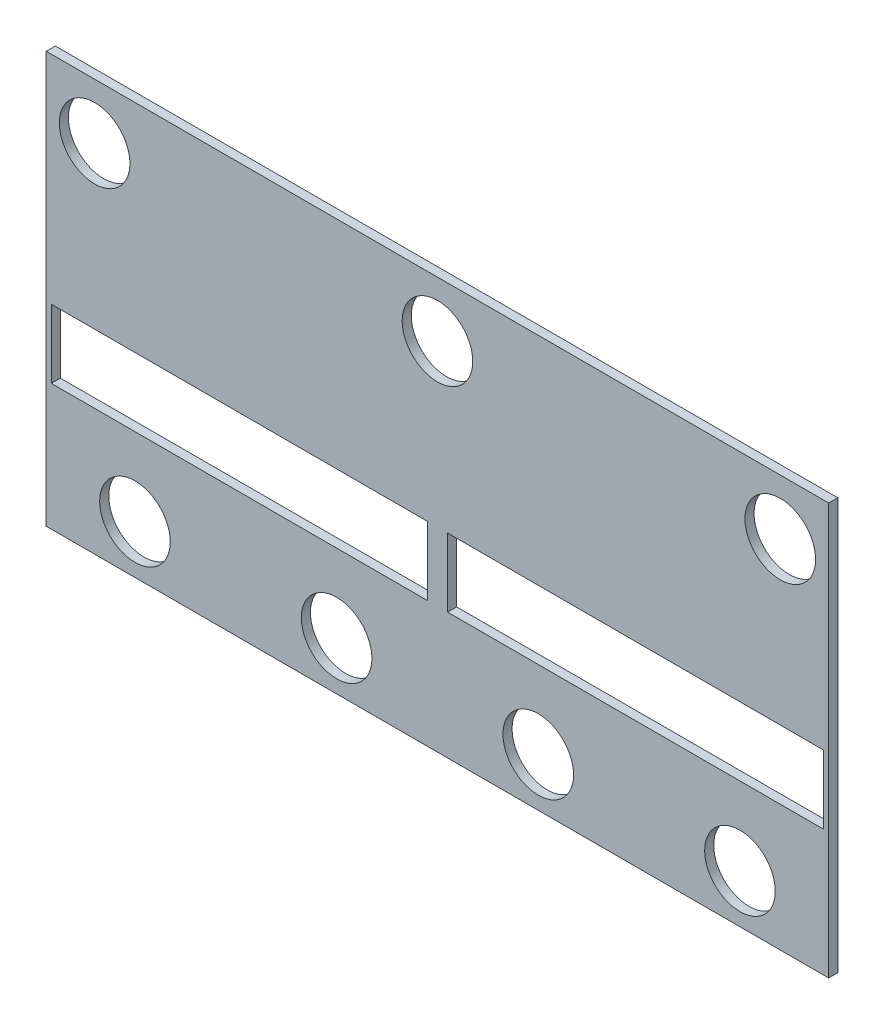
from build123d import *

# Parameters (mm, degrees)
SKETCH14_W                        = 80
SKETCH14_H                        = 42
SKETCH14_W_2                      = 3.75
SKETCH14_H_2                      = 3.75
BASE_WITH_CUTOUTS_DEPTH           = 3
SKETCH15_W                        = 4.3
SKETCH15_H                        = 4.8
SIPM_CUTOUTS_DEPTH                = 48.265209192
PADDLE_SUPPORT_TAPERS_DEPTH       = 2
SKETCH17_W                        = 80
SKETCH17_H                        = 25
PADDLE_SUPPORT_TOP_DEPTH          = 1
PADDLE_START                      = -4
SKETCH17_2_W                      = 80
SKETCH17_2_H                      = 25
PADDLE_SUPPORT_BOTTOM_DEPTH       = 1
PADDLE_SUPPORT_TAPER_TOP_SIZE     = 0.8
PADDLE_SUPPORT_TAPER_TOP_SIZE2    = 2.4
PADDLE_SUPPORT_TAPER_BOTTOM_SIZE  = 2.4
PADDLE_SUPPORT_TAPER_BOTTOM_SIZE2 = 0.8
SKETCH18_W                        = 4
SKETCH18_H                        = 22
SKETCH18_H_2                      = 14
BASE_THICKNESS_EXPANSION_DEPTH    = 80
BAFFLE_BASE_DEPTH                 = 2
BAFFLE_LIP_DEPTH                  = 2
BAFFLE_CHAMFER_1_2_SIZE           = 1.2
BAFFLE_CHAMFER_0_4_SIZE           = 0.4
INSERT_HOLES_PCB_D                = 3.3
INSERT_HOLES_PCB_DEPTH            = 4.2
INSERT_HOLES_PCB_CBORE_D          = 7
INSERT_HOLES_PCB_CBORE_DEPTH      = 1.4
JOINT_MOD_REACH                   = 56.854
SKETCH29_W                        = 37.3
SKETCH29_H                        = 6.8
CUT_EXTRUDE1_DEPTH                = 1.45
CHAMFER1_SIZE                     = 2
CHAMFER1_SIZE2                    = 5.494954839
SKETCH34_W                        = 81.499638764
SKETCH34_H                        = 0.25
CUT_EXTRUDE2_DEPTH                = 24
M1_6_CLEARANCE_HOLE1_D            = 1.8
SKETCH38_W                        = 104.100396554
SKETCH38_H                        = 54.802140704
CUT_EXTRUDE3_DEPTH                = 55.128573785
CUT_EXTRUDE4_DEPTH                = 0.05
SKETCH40_W                        = 1.2
SKETCH40_H                        = 9
CUT_EXTRUDE5_DEPTH                = 48.190677045
SKETCH41_W                        = 77.6
SKETCH41_H                        = 40.8
CUT_EXTRUDE6_DEPTH                = 0.5


with BuildPart() as part:
    # Sketch14 → BASE WITH CUTOUTS (new body)
    with BuildSketch(Plane.XY):
        with Locations((0, 4)):
            Rectangle(SKETCH14_W, SKETCH14_H)
        with Locations((10.45, 0)):
            Rectangle(SKETCH14_W_2, SKETCH14_H_2, mode=Mode.SUBTRACT)
        with Locations((4.15, 0)):
            Rectangle(SKETCH14_W_2, SKETCH14_H_2, mode=Mode.SUBTRACT)
        with Locations((16.75, 0)):
            Rectangle(SKETCH14_W_2, SKETCH14_H_2, mode=Mode.SUBTRACT)
        with Locations((23.05, 0)):
            Rectangle(SKETCH14_W_2, SKETCH14_H_2, mode=Mode.SUBTRACT)
        with Locations((29.35, 0)):
            Rectangle(SKETCH14_W_2, SKETCH14_H_2, mode=Mode.SUBTRACT)
        with Locations((35.65, 0)):
            Rectangle(SKETCH14_W_2, SKETCH14_H_2, mode=Mode.SUBTRACT)
        with Locations((-35.65, 0)):
            Rectangle(SKETCH14_W_2, SKETCH14_H_2, mode=Mode.SUBTRACT)
        with Locations((-29.35, 0)):
            Rectangle(SKETCH14_W_2, SKETCH14_H_2, mode=Mode.SUBTRACT)
        with Locations((-23.05, 0)):
            Rectangle(SKETCH14_W_2, SKETCH14_H_2, mode=Mode.SUBTRACT)
        with Locations((-16.75, 0)):
            Rectangle(SKETCH14_W_2, SKETCH14_H_2, mode=Mode.SUBTRACT)
        with Locations((-10.45, 0)):
            Rectangle(SKETCH14_W_2, SKETCH14_H_2, mode=Mode.SUBTRACT)
        with Locations((-4.15, 0)):
            Rectangle(SKETCH14_W_2, SKETCH14_H_2, mode=Mode.SUBTRACT)
    extrude(amount=-BASE_WITH_CUTOUTS_DEPTH)

    # Sketch15 → SIPM CUTOUTS (cut, through all)
    with BuildSketch(Plane(origin=(0, 0, -3), x_dir=(-1, 0, 0), z_dir=(0, 0, -1))):
        with Locations((-35.65, 0.125)):
            Rectangle(SKETCH15_W, SKETCH15_H)
        with Locations((-29.35, 0.125)):
            Rectangle(SKETCH15_W, SKETCH15_H)
        with Locations((-23.05, 0.125)):
            Rectangle(SKETCH15_W, SKETCH15_H)
        with Locations((-16.75, 0.125)):
            Rectangle(SKETCH15_W, SKETCH15_H)
        with Locations((-10.45, 0.125)):
            Rectangle(SKETCH15_W, SKETCH15_H)
        with Locations((-4.15, 0.125)):
            Rectangle(SKETCH15_W, SKETCH15_H)
        with Locations((4.15, 0.125)):
            Rectangle(SKETCH15_W, SKETCH15_H)
        with Locations((10.45, 0.125)):
            Rectangle(SKETCH15_W, SKETCH15_H)
        with Locations((16.75, 0.125)):
            Rectangle(SKETCH15_W, SKETCH15_H)
        with Locations((23.05, 0.125)):
            Rectangle(SKETCH15_W, SKETCH15_H)
        with Locations((29.35, 0.125)):
            Rectangle(SKETCH15_W, SKETCH15_H)
        with Locations((35.65, 0.125)):
            Rectangle(SKETCH15_W, SKETCH15_H)
    extrude(amount=-SIPM_CUTOUTS_DEPTH, mode=Mode.SUBTRACT)

    # Sketch16 → PADDLE SUPPORT - TAPERS (add, symmetric)
    with BuildSketch(Plane(origin=(0, 0, 0), x_dir=(1, 0, 0), z_dir=(0, 1, 0))):
        Polygon((40, 0), (37.691381155, 0), (40, -16.789955233), align=None)
        Polygon((0, 0), (2.308618845, 0), (0, -16.789955233), (-2.308618845, 0), align=None)
        Polygon((-40, -16.789955233), (-37.691381155, 0), (-40, 0), align=None)
    extrude(amount=PADDLE_SUPPORT_TAPERS_DEPTH, both=True)

    # Sketch17 → PADDLE SUPPORT - TOP (add)
    with BuildSketch(Plane(origin=(0, 2, 0), x_dir=(1, 0, 0), z_dir=(0, 1, 0))):
        with Locations((0, -12.5)):
            Rectangle(SKETCH17_W, SKETCH17_H)
    extrude(amount=PADDLE_SUPPORT_TOP_DEPTH)

    # Sketch17<2> → PADDLE SUPPORT - BOTTOM (add)
    with BuildSketch(Plane(origin=(0, 2, 0), x_dir=(1, 0, 0), z_dir=(0, 1, 0)).offset(PADDLE_START)):
        with Locations((0, -12.5)):
            Rectangle(SKETCH17_2_W, SKETCH17_2_H)
    extrude(amount=-PADDLE_SUPPORT_BOTTOM_DEPTH)

    # PADDLE SUPPORT - TAPER TOP
    paddle_support_taper_top_edges = [part.edges().sort_by_distance(p)[0] for p in [
        (0, 3, 25),
    ]]
    paddle_support_taper_top_side = [part.faces().sort_by_distance(p)[0] for p in [
        (0, 2.5, 25),
    ]]
    chamfer(paddle_support_taper_top_edges, length=PADDLE_SUPPORT_TAPER_TOP_SIZE, length2=PADDLE_SUPPORT_TAPER_TOP_SIZE2, reference=paddle_support_taper_top_side[0])

    # PADDLE SUPPORT - TAPER BOTTOM
    paddle_support_taper_bottom_edges = [part.edges().sort_by_distance(p)[0] for p in [
        (0, -3, 25),
    ]]
    paddle_support_taper_bottom_side = [part.faces().sort_by_distance(p)[0] for p in [
        (0, -3, 12.5),
    ]]
    chamfer(paddle_support_taper_bottom_edges, length=PADDLE_SUPPORT_TAPER_BOTTOM_SIZE, length2=PADDLE_SUPPORT_TAPER_BOTTOM_SIZE2, reference=paddle_support_taper_bottom_side[0])

    # Sketch18 → BASE - THICKNESS EXPANSION (add)
    with BuildSketch(Plane(origin=(40, 0, 0), x_dir=(0, 0, -1), z_dir=(1, 0, 0))):
        with Locations((-2, 14)):
            Rectangle(SKETCH18_W, SKETCH18_H)
        with Locations((-2, -10)):
            Rectangle(SKETCH18_W, SKETCH18_H_2)
    extrude(amount=-BASE_THICKNESS_EXPANSION_DEPTH)

    # Sketch19 → BAFFLE - BASE (cut)
    with BuildSketch(Plane(origin=(0, 0, -3), x_dir=(-1, 0, 0), z_dir=(0, 0, -1))):
        Polygon((-40, 16), (-39.2, 16), (-39.2, -16.2), (39.2, -16.2), (39.2, 16), (40, 16), (40, -17), (-40, -17), align=None)
    extrude(amount=-BAFFLE_BASE_DEPTH, mode=Mode.SUBTRACT)

    # Sketch20 → BAFFLE - LIP (cut)
    with BuildSketch(Plane(origin=(0, 0, -1), x_dir=(-1, 0, 0), z_dir=(0, 0, -1))):
        Polygon((-40, 16), (-40, -17), (40, -17), (40, 16), (38.8, 16), (38.8, -15.8), (-38.8, -15.8), (-38.8, 16), align=None)
    extrude(amount=-BAFFLE_LIP_DEPTH, mode=Mode.SUBTRACT)

    # BAFFLE - CHAMFER 1.2
    baffle_chamfer_1_2_edges = [part.edges().sort_by_distance(p)[0] for p in [
        (-40, -0.5, 1),
        (0, -17, 1),
        (40, -0.5, 1),
    ]]
    chamfer(baffle_chamfer_1_2_edges, length=BAFFLE_CHAMFER_1_2_SIZE - 0.0001)  # a hair under: the kernel refuses the full size

    # BAFFLE - CHAMFER 0.4
    baffle_chamfer_0_4_edges = [part.edges().sort_by_distance(p)[0] for p in [
        (39.2, -0.1, -1),
        (-39.2, -0.1, -1),
        (0, -16.2, -1),
    ]]
    chamfer(baffle_chamfer_0_4_edges, length=BAFFLE_CHAMFER_0_4_SIZE - 0.0001)  # a hair under: the kernel refuses the full size

    # INSERT HOLES - PCB
    with Locations(Plane(origin=(0, 0, -3), x_dir=(-1, 0, 0), z_dir=(0, 0, -1))):
        with Locations((-30, -11), (-10, -11), (10, -11), (30, -11), (-34, 19.5), (0, 19.5), (34, 19.5)):
            CounterBoreHole(INSERT_HOLES_PCB_D / 2, INSERT_HOLES_PCB_CBORE_D / 2, INSERT_HOLES_PCB_CBORE_DEPTH, depth=INSERT_HOLES_PCB_DEPTH)

    # Sketch26 → JOINT MOD (cut, up to next)
    with BuildSketch(Plane(origin=(0, 0, -3), x_dir=(-1, 0, 0), z_dir=(0, 0, -1)), mode=Mode.PRIVATE) as joint_mod_sk1:
        Polygon((-38.8, 16), (-38.8, -15.8), (38.8, -15.8), (38.8, 16), (39.2, 16), (39.2, -16.2), (-39.2, -16.2), (-39.2, 16), align=None)
    joint_mod_tool1 = extrude(joint_mod_sk1.sketch, amount=-JOINT_MOD_REACH, mode=Mode.PRIVATE) & part.part
    add(joint_mod_tool1.solids().sort_by_distance((38.884755, 0.1, -3))[0], mode=Mode.SUBTRACT)

    # Sketch29 → Cut-Extrude1 (cut)
    with BuildSketch(Plane(origin=(0, 0, -3), x_dir=(-1, 0, 0), z_dir=(0, 0, -1))):
        with Locations((-19.65, 0.125)):
            Rectangle(SKETCH29_W, SKETCH29_H)
        with Locations((19.65, 0.125)):
            Rectangle(SKETCH29_W, SKETCH29_H)
    extrude(amount=-CUT_EXTRUDE1_DEPTH, mode=Mode.SUBTRACT)

    # Chamfer1
    chamfer1_edges = [part.edges().sort_by_distance(p)[0] for p in [
        (0, 3, 4),
    ]]
    chamfer1_side = [part.faces().sort_by_distance(p)[0] for p in [
        (0, 3, 13.3),
    ]]
    chamfer(chamfer1_edges, length=CHAMFER1_SIZE, length2=CHAMFER1_SIZE2, reference=chamfer1_side[0])

    # Sketch34 → Cut-Extrude2 (cut)
    with BuildSketch(Plane.XY.offset(25)):
        Rectangle(SKETCH34_W, SKETCH34_H)
    extrude(amount=-CUT_EXTRUDE2_DEPTH, mode=Mode.SUBTRACT)

    # M1.6 Clearance Hole1 (through all)
    with Locations(Plane(origin=(0, -3, 0), x_dir=(-1, 0, 0), z_dir=(0, -1, 0))):
        with Locations((0, -8)):
            Hole(M1_6_CLEARANCE_HOLE1_D / 2)

    # Sketch38 → Cut-Extrude3 (cut, through all)
    with BuildSketch(Plane(origin=(0, 0, -1.55), x_dir=(-1, 0, 0), z_dir=(0, 0, -1))):
        Rectangle(SKETCH38_W, SKETCH38_H)
    extrude(amount=-CUT_EXTRUDE3_DEPTH, mode=Mode.SUBTRACT)

    # Sketch39 → Cut-Extrude4 (cut)
    with BuildSketch(Plane.XY.offset(-1.55)):
        Polygon((40, 25), (-40, 25), (-40, 16), (-38.8, 16), (-38.8, -15.8), (38.8, -15.8), (38.8, 16), (40, 16), align=None)
    extrude(amount=-CUT_EXTRUDE4_DEPTH, mode=Mode.SUBTRACT)

    # Sketch40 → Cut-Extrude5 (cut, through all)
    with BuildSketch(Plane.XY.offset(-1.6)):
        with Locations((-39.4, 20.5)):
            Rectangle(SKETCH40_W, SKETCH40_H)
        with Locations((39.4, 20.5)):
            Rectangle(SKETCH40_W, SKETCH40_H)
    extrude(amount=-CUT_EXTRUDE5_DEPTH, mode=Mode.SUBTRACT)

    # Sketch41 → Cut-Extrude6 (cut)
    with BuildSketch(Plane.XY.offset(-1.6)):
        with Locations((0, 4.6)):
            Rectangle(SKETCH41_W, SKETCH41_H)
    extrude(amount=-CUT_EXTRUDE6_DEPTH, mode=Mode.SUBTRACT)


solid = part.part
